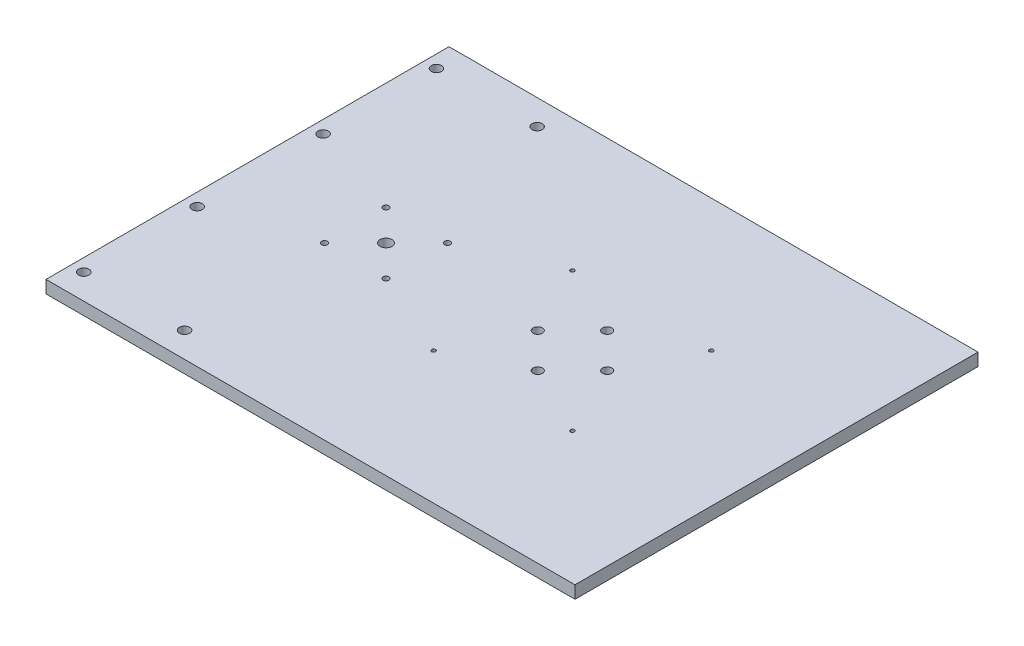
from build123d import *

# Parameters (mm, degrees)
SKETCH1_W           = 266.7
SKETCH1_H           = 203.2
BOSS_EXTRUDE1_DEPTH = 6.35
SKETCH3_R           = 2.600000007
CUT_EXTRUDE1_DEPTH  = 168.765029133
SKETCH5_R           = 1.5
SKETCH5_R_2         = 3.007999953
CUT_EXTRUDE2_DEPTH  = 168.765029133
SKETCH7_R           = 0.999998
CUT_EXTRUDE3_DEPTH  = 168.765029133
SKETCH8_R           = 2.35
CUT_EXTRUDE4_DEPTH  = 168.765029133


with BuildPart() as part:
    # Sketch1 → Boss-Extrude1 (new body)
    with BuildSketch(Plane(origin=(0, 0, 0), x_dir=(1, 0, 0), z_dir=(0, 1, 0))):
        Rectangle(SKETCH1_W, SKETCH1_H)
    extrude(amount=BOSS_EXTRUDE1_DEPTH)

    # Sketch3 → Cut-Extrude1 (cut, through all)
    with BuildSketch(Plane(origin=(0, 6.35, 0), x_dir=(1, 0, 0), z_dir=(0, 1, 0))):
        with Locations((-127, -31.75)):
            Circle(SKETCH3_R)
        with Locations((-76.2, -88.9)):
            Circle(SKETCH3_R)
        with Locations((-127, -88.9)):
            Circle(SKETCH3_R)
    cut_extrude1 = extrude(amount=-CUT_EXTRUDE1_DEPTH, mode=Mode.SUBTRACT)

    # Mirror1: Cut-Extrude1 across plane
    add(cut_extrude1.mirror(Plane.XY), mode=Mode.SUBTRACT)

    # Sketch5 → Cut-Extrude2 (cut, through all)
    with BuildSketch(Plane(origin=(0, 6.35, 0), x_dir=(1, 0, 0), z_dir=(0, 1, 0))):
        with Locations((-48.024, 15.5)):
            Circle(SKETCH5_R)
        with Locations((-48.024, -15.5)):
            Circle(SKETCH5_R)
        with Locations((-79.024, 15.5)):
            Circle(SKETCH5_R)
        with Locations((-79.024, -15.5)):
            Circle(SKETCH5_R)
        with Locations((-63.524, 0)):
            Circle(SKETCH5_R_2)
    extrude(amount=-CUT_EXTRUDE2_DEPTH, mode=Mode.SUBTRACT)

    # Sketch7 → Cut-Extrude3 (cut, through all)
    with BuildSketch(Plane(origin=(0, 6.35, 0), x_dir=(1, 0, 0), z_dir=(0, 1, 0))):
        with Locations((65.481787492, -35.001787527)):
            Circle(SKETCH7_R)
        with Locations((-4.521787522, -35.001787527)):
            Circle(SKETCH7_R)
        with Locations((-4.521787522, 35.001787488)):
            Circle(SKETCH7_R)
        with Locations((65.481787492, 35.001787488)):
            Circle(SKETCH7_R)
    extrude(amount=-CUT_EXTRUDE3_DEPTH, mode=Mode.SUBTRACT)

    # Sketch8 → Cut-Extrude4 (cut, through all)
    with BuildSketch(Plane(origin=(0, 6.35, 0), x_dir=(1, 0, 0), z_dir=(0, 1, 0))):
        with Locations((12.98, 0)):
            Circle(SKETCH8_R)
        with Locations((47.98, 0)):
            Circle(SKETCH8_R)
        with BuildLine():
            ThreePointArc((30.48, -19.85), (32.83, -17.5), (30.48, -15.15))
            ThreePointArc((30.48, -15.15), (28.13, -17.5), (30.48, -19.85))
        make_face()
        with BuildLine():
            ThreePointArc((30.48, 15.15), (32.83, 17.5), (30.48, 19.85))
            ThreePointArc((30.48, 19.85), (28.13, 17.5), (30.48, 15.15))
        make_face()
    extrude(amount=-CUT_EXTRUDE4_DEPTH, mode=Mode.SUBTRACT)


solid = part.part
